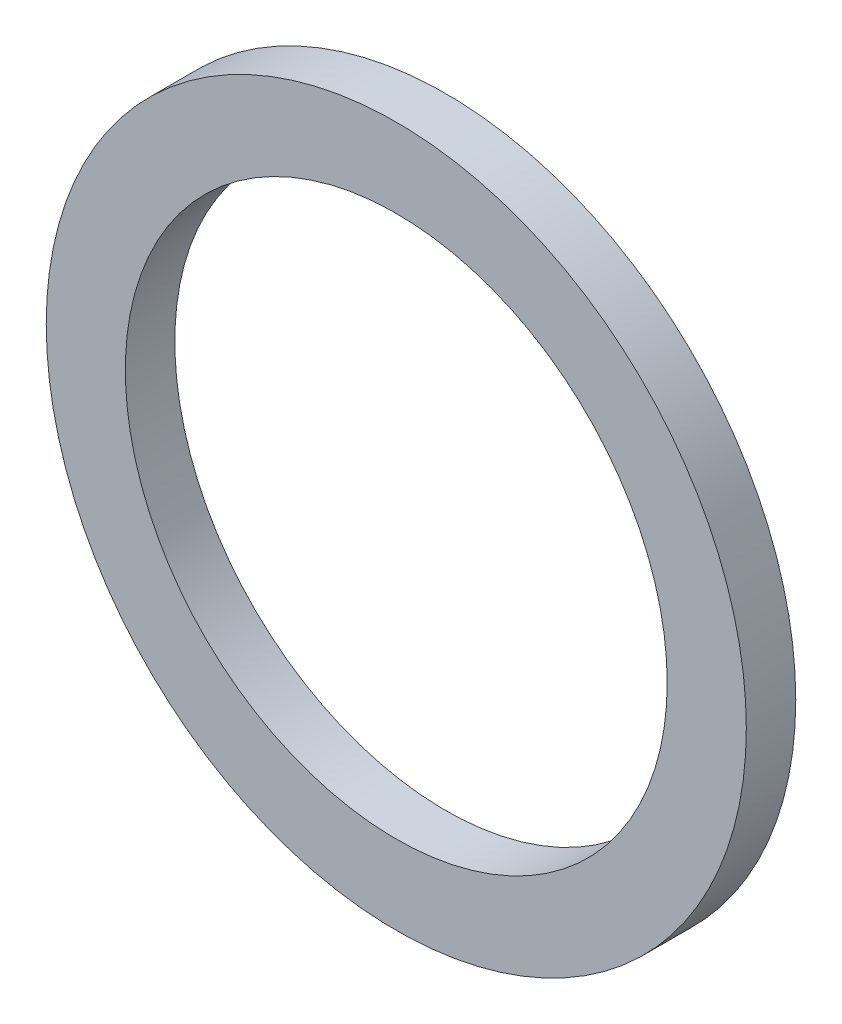
from build123d import *

# Parameters (mm, degrees)
SKETCH1_R           = 22.479
SKETCH1_R_2         = 17.399
BOSS_EXTRUDE1_DEPTH = 3.175


with BuildPart() as part:
    # Sketch1 → Boss-Extrude1 (new body)
    with BuildSketch(Plane.XY):
        Circle(SKETCH1_R)
        Circle(SKETCH1_R_2, mode=Mode.SUBTRACT)
    extrude(amount=BOSS_EXTRUDE1_DEPTH)


solid = part.part
